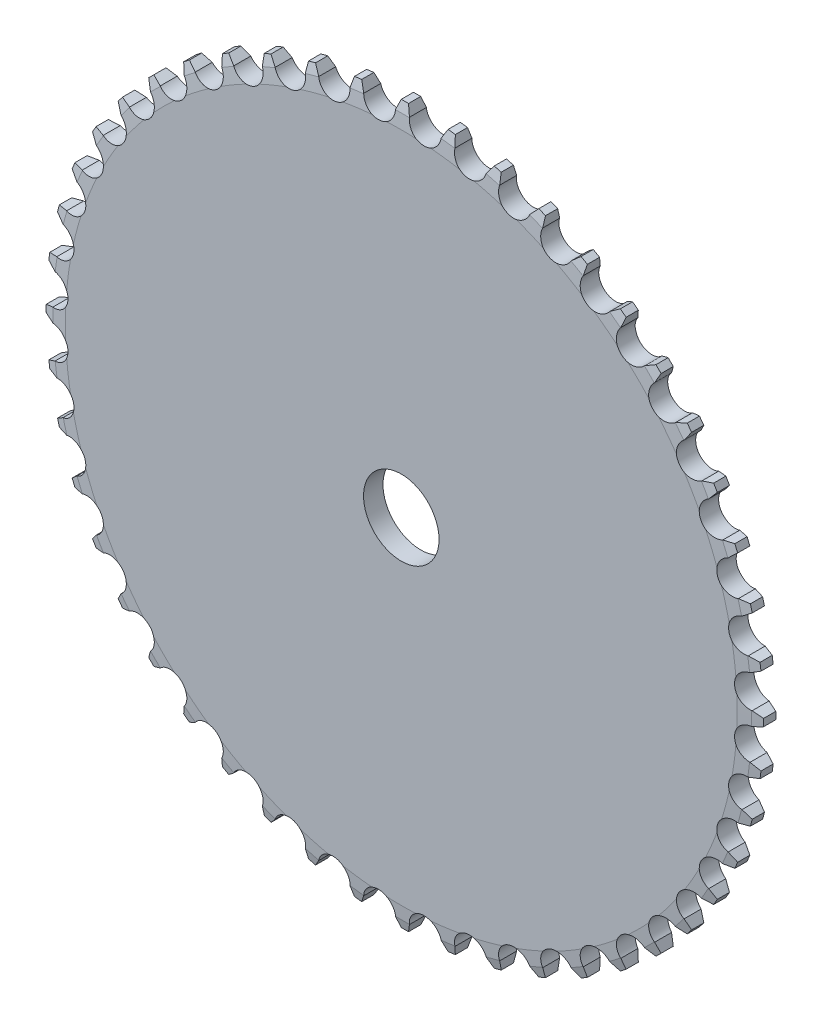
from build123d import *

# Parameters (mm, degrees)
SKETCH1_R           = 7.9375
BOSS_EXTRUDE2_DEPTH = 4.0894


with BuildPart() as part:
    # Sketch1 → Boss-Extrude2 (new body)
    with BuildSketch(Plane.XY):
        with BuildLine():
            Line((0.762, 75.421450769), (-0.762, 75.421450769))
            Line((-0.762, 75.421450769), (-1.456984931, 73.511995363))
            ThreePointArc((-1.456984931, 73.511995363), (-2.339997211, 71.173530048), (-4.594157789, 70.093302846))
            ThreePointArc((-4.594157789, 70.093302846), (-6.970031654, 70.870061558), (-8.150720614, 73.073264748))
            Line((-8.150720614, 73.073264748), (-9.088993796, 74.875670761))
            Line((-9.088993796, 74.875670761), (-10.599955765, 74.676748844))
            Line((-10.599955765, 74.676748844), (-11.03976106, 72.692915357))
            ThreePointArc((-11.03976106, 72.692915357), (-11.609988074, 70.259199706), (-13.703866053, 68.893987001))
            ThreePointArc((-13.703866053, 68.893987001), (-16.160801344, 69.353986665), (-17.61896507, 71.384230312))
            Line((-17.61896507, 71.384230312), (-18.784472389, 73.048747266))
            Line((-18.784472389, 73.048747266), (-20.256543348, 72.654307042))
            Line((-20.256543348, 72.654307042), (-20.433643817, 70.630039415))
            ThreePointArc((-20.433643817, 70.630039415), (-20.681328823, 68.142714978), (-22.579097369, 66.515875937))
            ThreePointArc((-22.579097369, 66.515875937), (-25.075055243, 66.651245832), (-26.785744149, 68.473791905))
            Line((-26.785744149, 68.473791905), (-28.15854345, 69.971939453))
            Line((-28.15854345, 69.971939453), (-29.566535858, 69.388729902))
            Line((-29.566535858, 69.388729902), (-29.477901263, 67.358663916))
            ThreePointArc((-29.477901263, 67.358663916), (-29.398806302, 64.860289504), (-31.067994069, 62.999659794))
            ThreePointArc((-31.067994069, 62.999659794), (-33.560267995, 62.808083704), (-35.494211718, 64.391747933))
            Line((-35.494211718, 64.391747933), (-37.050814027, 65.697892356))
            Line((-37.050814027, 65.697892356), (-38.370636742, 64.935892356))
            Line((-38.370636742, 64.935892356), (-38.017783645, 62.934763002))
            ThreePointArc((-38.017783645, 62.934763002), (-37.613262053, 60.468086493), (-39.025308777, 58.405502006))
            ThreePointArc((-39.025308777, 58.405502006), (-41.471255256, 57.89025785), (-43.595363485, 59.207943302))
            Line((-43.595363485, 59.207943302), (-45.309134903, 60.299736106))
            Line((-45.309134903, 60.299736106), (-46.518205393, 59.371983688))
            Line((-46.518205393, 59.371983688), (-45.907171209, 57.434030844))
            ThreePointArc((-45.907171209, 57.434030844), (-45.184144463, 55.041257758), (-46.314889632, 52.812009885))
            ThreePointArc((-46.314889632, 52.812009885), (-48.672657842, 51.981913634), (-50.950586495, 53.011074345))
            Line((-50.950586495, 53.011074345), (-52.792203918, 53.869834653))
            Line((-52.792203918, 53.869834653), (-53.869834653, 52.792203918))
            Line((-53.869834653, 52.792203918), (-53.011074345, 50.950586495))
            ThreePointArc((-53.011074345, 50.950586495), (-51.981913634, 48.672657842), (-52.812009885, 46.314889632))
            ThreePointArc((-52.812009885, 46.314889632), (-55.041257758, 45.184144463), (-57.434030844, 45.907171209))
            Line((-57.434030844, 45.907171209), (-59.371983688, 46.518205393))
            Line((-59.371983688, 46.518205393), (-60.299736106, 45.309134903))
            Line((-60.299736106, 45.309134903), (-59.207943302, 43.595363485))
            ThreePointArc((-59.207943302, 43.595363485), (-57.89025785, 41.471255256), (-58.405502006, 39.025308777))
            ThreePointArc((-58.405502006, 39.025308777), (-60.468086493, 37.613262053), (-62.934763002, 38.017783645))
            Line((-62.934763002, 38.017783645), (-64.935892356, 38.370636742))
            Line((-64.935892356, 38.370636742), (-65.697892356, 37.050814027))
            Line((-65.697892356, 37.050814027), (-64.391747933, 35.494211718))
            ThreePointArc((-64.391747933, 35.494211718), (-62.808083704, 33.560267995), (-62.999659794, 31.067994069))
            ThreePointArc((-62.999659794, 31.067994069), (-64.860289504, 29.398806302), (-67.358663916, 29.477901263))
            Line((-67.358663916, 29.477901263), (-69.388729902, 29.566535858))
            Line((-69.388729902, 29.566535858), (-69.971939453, 28.15854345))
            Line((-69.971939453, 28.15854345), (-68.473791905, 26.785744149))
            ThreePointArc((-68.473791905, 26.785744149), (-66.651245832, 25.075055243), (-66.515875937, 22.579097369))
            ThreePointArc((-66.515875937, 22.579097369), (-68.142714978, 20.681328823), (-70.630039415, 20.433643817))
            Line((-70.630039415, 20.433643817), (-72.654307042, 20.256543348))
            Line((-72.654307042, 20.256543348), (-73.048747266, 18.784472389))
            Line((-73.048747266, 18.784472389), (-71.384230312, 17.61896507))
            ThreePointArc((-71.384230312, 17.61896507), (-69.353986665, 16.160801344), (-68.893987001, 13.703866053))
            ThreePointArc((-68.893987001, 13.703866053), (-70.259199706, 11.609988074), (-72.692915357, 11.03976106))
            Line((-72.692915357, 11.03976106), (-74.676748844, 10.599955765))
            Line((-74.676748844, 10.599955765), (-74.875670761, 9.088993796))
            Line((-74.875670761, 9.088993796), (-73.073264748, 8.150720614))
            ThreePointArc((-73.073264748, 8.150720614), (-70.870061558, 6.970031654), (-70.093302846, 4.594157789))
            ThreePointArc((-70.093302846, 4.594157789), (-71.173530048, 2.339997211), (-73.511995363, 1.456984931))
            Line((-73.511995363, 1.456984931), (-75.421450769, 0.762))
            Line((-75.421450769, 0.762), (-75.421450769, -0.762))
            Line((-75.421450769, -0.762), (-73.511995363, -1.456984931))
            ThreePointArc((-73.511995363, -1.456984931), (-71.173530048, -2.339997211), (-70.093302846, -4.594157789))
            ThreePointArc((-70.093302846, -4.594157789), (-70.870061558, -6.970031654), (-73.073264748, -8.150720614))
            Line((-73.073264748, -8.150720614), (-74.875670761, -9.088993796))
            Line((-74.875670761, -9.088993796), (-74.676748844, -10.599955765))
            Line((-74.676748844, -10.599955765), (-72.692915357, -11.03976106))
            ThreePointArc((-72.692915357, -11.03976106), (-70.259199706, -11.609988074), (-68.893987001, -13.703866053))
            ThreePointArc((-68.893987001, -13.703866053), (-69.353986665, -16.160801344), (-71.384230312, -17.61896507))
            Line((-71.384230312, -17.61896507), (-73.048747266, -18.784472389))
            Line((-73.048747266, -18.784472389), (-72.654307042, -20.256543348))
            Line((-72.654307042, -20.256543348), (-70.630039415, -20.433643817))
            ThreePointArc((-70.630039415, -20.433643817), (-68.142714978, -20.681328823), (-66.515875937, -22.579097369))
            ThreePointArc((-66.515875937, -22.579097369), (-66.651245832, -25.075055243), (-68.473791905, -26.785744149))
            Line((-68.473791905, -26.785744149), (-69.971939453, -28.15854345))
            Line((-69.971939453, -28.15854345), (-69.388729902, -29.566535858))
            Line((-69.388729902, -29.566535858), (-67.358663916, -29.477901263))
            ThreePointArc((-67.358663916, -29.477901263), (-64.860289504, -29.398806302), (-62.999659794, -31.067994069))
            ThreePointArc((-62.999659794, -31.067994069), (-62.808083704, -33.560267995), (-64.391747933, -35.494211718))
            Line((-64.391747933, -35.494211718), (-65.697892356, -37.050814027))
            Line((-65.697892356, -37.050814027), (-64.935892356, -38.370636742))
            Line((-64.935892356, -38.370636742), (-62.934763002, -38.017783645))
            ThreePointArc((-62.934763002, -38.017783645), (-60.468086493, -37.613262053), (-58.405502006, -39.025308777))
            ThreePointArc((-58.405502006, -39.025308777), (-57.89025785, -41.471255256), (-59.207943302, -43.595363485))
            Line((-59.207943302, -43.595363485), (-60.299736106, -45.309134903))
            Line((-60.299736106, -45.309134903), (-59.371983688, -46.518205393))
            Line((-59.371983688, -46.518205393), (-57.434030844, -45.907171209))
            ThreePointArc((-57.434030844, -45.907171209), (-55.041257758, -45.184144463), (-52.812009885, -46.314889632))
            ThreePointArc((-52.812009885, -46.314889632), (-51.981913634, -48.672657842), (-53.011074345, -50.950586495))
            Line((-53.011074345, -50.950586495), (-53.869834653, -52.792203918))
            Line((-53.869834653, -52.792203918), (-52.792203918, -53.869834653))
            Line((-52.792203918, -53.869834653), (-50.950586495, -53.011074345))
            ThreePointArc((-50.950586495, -53.011074345), (-48.672657842, -51.981913634), (-46.314889632, -52.812009885))
            ThreePointArc((-46.314889632, -52.812009885), (-45.184144463, -55.041257758), (-45.907171209, -57.434030844))
            Line((-45.907171209, -57.434030844), (-46.518205393, -59.371983688))
            Line((-46.518205393, -59.371983688), (-45.309134903, -60.299736106))
            Line((-45.309134903, -60.299736106), (-43.595363485, -59.207943302))
            ThreePointArc((-43.595363485, -59.207943302), (-41.471255256, -57.89025785), (-39.025308777, -58.405502006))
            ThreePointArc((-39.025308777, -58.405502006), (-37.613262053, -60.468086493), (-38.017783645, -62.934763002))
            Line((-38.017783645, -62.934763002), (-38.370636742, -64.935892356))
            Line((-38.370636742, -64.935892356), (-37.050814027, -65.697892356))
            Line((-37.050814027, -65.697892356), (-35.494211718, -64.391747933))
            ThreePointArc((-35.494211718, -64.391747933), (-33.560267995, -62.808083704), (-31.067994069, -62.999659794))
            ThreePointArc((-31.067994069, -62.999659794), (-29.398806302, -64.860289504), (-29.477901263, -67.358663916))
            Line((-29.477901263, -67.358663916), (-29.566535858, -69.388729902))
            Line((-29.566535858, -69.388729902), (-28.15854345, -69.971939453))
            Line((-28.15854345, -69.971939453), (-26.785744149, -68.473791905))
            ThreePointArc((-26.785744149, -68.473791905), (-25.075055243, -66.651245832), (-22.579097369, -66.515875937))
            ThreePointArc((-22.579097369, -66.515875937), (-20.681328823, -68.142714978), (-20.433643817, -70.630039415))
            Line((-20.433643817, -70.630039415), (-20.256543348, -72.654307042))
            Line((-20.256543348, -72.654307042), (-18.784472389, -73.048747266))
            Line((-18.784472389, -73.048747266), (-17.61896507, -71.384230312))
            ThreePointArc((-17.61896507, -71.384230312), (-16.160801344, -69.353986665), (-13.703866053, -68.893987001))
            ThreePointArc((-13.703866053, -68.893987001), (-11.609988074, -70.259199706), (-11.03976106, -72.692915357))
            Line((-11.03976106, -72.692915357), (-10.599955765, -74.676748844))
            Line((-10.599955765, -74.676748844), (-9.088993796, -74.875670761))
            Line((-9.088993796, -74.875670761), (-8.150720614, -73.073264748))
            ThreePointArc((-8.150720614, -73.073264748), (-6.970031654, -70.870061558), (-4.594157789, -70.093302846))
            ThreePointArc((-4.594157789, -70.093302846), (-2.339997211, -71.173530048), (-1.456984931, -73.511995363))
            Line((-1.456984931, -73.511995363), (-0.762, -75.421450769))
            Line((-0.762, -75.421450769), (0.762, -75.421450769))
            Line((0.762, -75.421450769), (1.456984931, -73.511995363))
            ThreePointArc((1.456984931, -73.511995363), (2.339997211, -71.173530048), (4.594157789, -70.093302846))
            ThreePointArc((4.594157789, -70.093302846), (6.970031654, -70.870061558), (8.150720614, -73.073264748))
            Line((8.150720614, -73.073264748), (9.088993796, -74.875670761))
            Line((9.088993796, -74.875670761), (10.599955765, -74.676748844))
            Line((10.599955765, -74.676748844), (11.03976106, -72.692915357))
            ThreePointArc((11.03976106, -72.692915357), (11.609988074, -70.259199706), (13.703866053, -68.893987001))
            ThreePointArc((13.703866053, -68.893987001), (16.160801344, -69.353986665), (17.61896507, -71.384230312))
            Line((17.61896507, -71.384230312), (18.784472389, -73.048747266))
            Line((18.784472389, -73.048747266), (20.256543348, -72.654307042))
            Line((20.256543348, -72.654307042), (20.433643817, -70.630039415))
            ThreePointArc((20.433643817, -70.630039415), (20.681328823, -68.142714978), (22.579097369, -66.515875937))
            ThreePointArc((22.579097369, -66.515875937), (25.075055243, -66.651245832), (26.785744149, -68.473791905))
            Line((26.785744149, -68.473791905), (28.15854345, -69.971939453))
            Line((28.15854345, -69.971939453), (29.566535858, -69.388729902))
            Line((29.566535858, -69.388729902), (29.477901263, -67.358663916))
            ThreePointArc((29.477901263, -67.358663916), (29.398806302, -64.860289504), (31.067994069, -62.999659794))
            ThreePointArc((31.067994069, -62.999659794), (33.560267995, -62.808083704), (35.494211718, -64.391747933))
            Line((35.494211718, -64.391747933), (37.050814027, -65.697892356))
            Line((37.050814027, -65.697892356), (38.370636742, -64.935892356))
            Line((38.370636742, -64.935892356), (38.017783645, -62.934763002))
            ThreePointArc((38.017783645, -62.934763002), (37.613262053, -60.468086493), (39.025308777, -58.405502006))
            ThreePointArc((39.025308777, -58.405502006), (41.471255256, -57.89025785), (43.595363485, -59.207943302))
            Line((43.595363485, -59.207943302), (45.309134903, -60.299736106))
            Line((45.309134903, -60.299736106), (46.518205393, -59.371983688))
            Line((46.518205393, -59.371983688), (45.907171209, -57.434030844))
            ThreePointArc((45.907171209, -57.434030844), (45.184144463, -55.041257758), (46.314889632, -52.812009885))
            ThreePointArc((46.314889632, -52.812009885), (48.672657842, -51.981913634), (50.950586495, -53.011074345))
            Line((50.950586495, -53.011074345), (52.792203918, -53.869834653))
            Line((52.792203918, -53.869834653), (53.869834653, -52.792203918))
            Line((53.869834653, -52.792203918), (53.011074345, -50.950586495))
            ThreePointArc((53.011074345, -50.950586495), (51.981913634, -48.672657842), (52.812009885, -46.314889632))
            ThreePointArc((52.812009885, -46.314889632), (55.041257758, -45.184144463), (57.434030844, -45.907171209))
            Line((57.434030844, -45.907171209), (59.371983688, -46.518205393))
            Line((59.371983688, -46.518205393), (60.299736106, -45.309134903))
            Line((60.299736106, -45.309134903), (59.207943302, -43.595363485))
            ThreePointArc((59.207943302, -43.595363485), (57.89025785, -41.471255256), (58.405502006, -39.025308777))
            ThreePointArc((58.405502006, -39.025308777), (60.468086493, -37.613262053), (62.934763002, -38.017783645))
            Line((62.934763002, -38.017783645), (64.935892356, -38.370636742))
            Line((64.935892356, -38.370636742), (65.697892356, -37.050814027))
            Line((65.697892356, -37.050814027), (64.391747933, -35.494211718))
            ThreePointArc((64.391747933, -35.494211718), (62.808083704, -33.560267995), (62.999659794, -31.067994069))
            ThreePointArc((62.999659794, -31.067994069), (64.860289504, -29.398806302), (67.358663916, -29.477901263))
            Line((67.358663916, -29.477901263), (69.388729902, -29.566535858))
            Line((69.388729902, -29.566535858), (69.971939453, -28.15854345))
            Line((69.971939453, -28.15854345), (68.473791905, -26.785744149))
            ThreePointArc((68.473791905, -26.785744149), (66.651245832, -25.075055243), (66.515875937, -22.579097369))
            ThreePointArc((66.515875937, -22.579097369), (68.142714978, -20.681328823), (70.630039415, -20.433643817))
            Line((70.630039415, -20.433643817), (72.654307042, -20.256543348))
            Line((72.654307042, -20.256543348), (73.048747266, -18.784472389))
            Line((73.048747266, -18.784472389), (71.384230312, -17.61896507))
            ThreePointArc((71.384230312, -17.61896507), (69.353986665, -16.160801344), (68.893987001, -13.703866053))
            ThreePointArc((68.893987001, -13.703866053), (70.259199706, -11.609988074), (72.692915357, -11.03976106))
            Line((72.692915357, -11.03976106), (74.676748844, -10.599955765))
            Line((74.676748844, -10.599955765), (74.875670761, -9.088993796))
            Line((74.875670761, -9.088993796), (73.073264748, -8.150720614))
            ThreePointArc((73.073264748, -8.150720614), (70.870061558, -6.970031654), (70.093302846, -4.594157789))
            ThreePointArc((70.093302846, -4.594157789), (71.173530048, -2.339997211), (73.511995363, -1.456984931))
            Line((73.511995363, -1.456984931), (75.421450769, -0.762))
            Line((75.421450769, -0.762), (75.421450769, 0.762))
            Line((75.421450769, 0.762), (73.511995363, 1.456984931))
            ThreePointArc((73.511995363, 1.456984931), (71.173530048, 2.339997211), (70.093302846, 4.594157789))
            ThreePointArc((70.093302846, 4.594157789), (70.870061558, 6.970031654), (73.073264748, 8.150720614))
            Line((73.073264748, 8.150720614), (74.875670761, 9.088993796))
            Line((74.875670761, 9.088993796), (74.676748844, 10.599955765))
            Line((74.676748844, 10.599955765), (72.692915357, 11.03976106))
            ThreePointArc((72.692915357, 11.03976106), (70.259199706, 11.609988074), (68.893987001, 13.703866053))
            ThreePointArc((68.893987001, 13.703866053), (69.353986665, 16.160801344), (71.384230312, 17.61896507))
            Line((71.384230312, 17.61896507), (73.048747266, 18.784472389))
            Line((73.048747266, 18.784472389), (72.654307042, 20.256543348))
            Line((72.654307042, 20.256543348), (70.630039415, 20.433643817))
            ThreePointArc((70.630039415, 20.433643817), (68.142714978, 20.681328823), (66.515875937, 22.579097369))
            ThreePointArc((66.515875937, 22.579097369), (66.651245832, 25.075055243), (68.473791905, 26.785744149))
            Line((68.473791905, 26.785744149), (69.971939453, 28.15854345))
            Line((69.971939453, 28.15854345), (69.388729902, 29.566535858))
            Line((69.388729902, 29.566535858), (67.358663916, 29.477901263))
            ThreePointArc((67.358663916, 29.477901263), (64.860289504, 29.398806302), (62.999659794, 31.067994069))
            ThreePointArc((62.999659794, 31.067994069), (62.808083704, 33.560267995), (64.391747933, 35.494211718))
            Line((64.391747933, 35.494211718), (65.697892356, 37.050814027))
            Line((65.697892356, 37.050814027), (64.935892356, 38.370636742))
            Line((64.935892356, 38.370636742), (62.934763002, 38.017783645))
            ThreePointArc((62.934763002, 38.017783645), (60.468086493, 37.613262053), (58.405502006, 39.025308777))
            ThreePointArc((58.405502006, 39.025308777), (57.89025785, 41.471255256), (59.207943302, 43.595363485))
            Line((59.207943302, 43.595363485), (60.299736106, 45.309134903))
            Line((60.299736106, 45.309134903), (59.371983688, 46.518205393))
            Line((59.371983688, 46.518205393), (57.434030844, 45.907171209))
            ThreePointArc((57.434030844, 45.907171209), (55.041257758, 45.184144463), (52.812009885, 46.314889632))
            ThreePointArc((52.812009885, 46.314889632), (51.981913634, 48.672657842), (53.011074345, 50.950586495))
            Line((53.011074345, 50.950586495), (53.869834653, 52.792203918))
            Line((53.869834653, 52.792203918), (52.792203918, 53.869834653))
            Line((52.792203918, 53.869834653), (50.950586495, 53.011074345))
            ThreePointArc((50.950586495, 53.011074345), (48.672657842, 51.981913634), (46.314889632, 52.812009885))
            ThreePointArc((46.314889632, 52.812009885), (45.184144463, 55.041257758), (45.907171209, 57.434030844))
            Line((45.907171209, 57.434030844), (46.518205393, 59.371983688))
            Line((46.518205393, 59.371983688), (45.309134903, 60.299736106))
            Line((45.309134903, 60.299736106), (43.595363485, 59.207943302))
            ThreePointArc((43.595363485, 59.207943302), (41.471255256, 57.89025785), (39.025308777, 58.405502006))
            ThreePointArc((39.025308777, 58.405502006), (37.613262053, 60.468086493), (38.017783645, 62.934763002))
            Line((38.017783645, 62.934763002), (38.370636742, 64.935892356))
            Line((38.370636742, 64.935892356), (37.050814027, 65.697892356))
            Line((37.050814027, 65.697892356), (35.494211718, 64.391747933))
            ThreePointArc((35.494211718, 64.391747933), (33.560267995, 62.808083704), (31.067994069, 62.999659794))
            ThreePointArc((31.067994069, 62.999659794), (29.398806302, 64.860289504), (29.477901263, 67.358663916))
            Line((29.477901263, 67.358663916), (29.566535858, 69.388729902))
            Line((29.566535858, 69.388729902), (28.15854345, 69.971939453))
            Line((28.15854345, 69.971939453), (26.785744149, 68.473791905))
            ThreePointArc((26.785744149, 68.473791905), (25.075055243, 66.651245832), (22.579097369, 66.515875937))
            ThreePointArc((22.579097369, 66.515875937), (20.681328823, 68.142714978), (20.433643817, 70.630039415))
            Line((20.433643817, 70.630039415), (20.256543348, 72.654307042))
            Line((20.256543348, 72.654307042), (18.784472389, 73.048747266))
            Line((18.784472389, 73.048747266), (17.61896507, 71.384230312))
            ThreePointArc((17.61896507, 71.384230312), (16.160801344, 69.353986665), (13.703866053, 68.893987001))
            ThreePointArc((13.703866053, 68.893987001), (11.609988074, 70.259199706), (11.03976106, 72.692915357))
            Line((11.03976106, 72.692915357), (10.599955765, 74.676748844))
            Line((10.599955765, 74.676748844), (9.088993796, 74.875670761))
            Line((9.088993796, 74.875670761), (8.150720614, 73.073264748))
            ThreePointArc((8.150720614, 73.073264748), (6.970031654, 70.870061558), (4.594157789, 70.093302846))
            ThreePointArc((4.594157789, 70.093302846), (2.339997211, 71.173530048), (1.456984931, 73.511995363))
            Line((1.456984931, 73.511995363), (0.762, 75.421450769))
        make_face()
        Circle(SKETCH1_R, mode=Mode.SUBTRACT)
    extrude(amount=BOSS_EXTRUDE2_DEPTH)

    # Sketch3 → Cut-Revolve3 (revolve, cut)
    with BuildSketch(Plane(origin=(0, 0, 0), x_dir=(0, 0, -1), z_dir=(1, 0, 0))):
        Polygon((-3.848714616, 73.457461189), (-3.3274, 75.421450769), (-3.3274, 76.364789012), (-4.752293352, 76.364789012), (-4.752293352, 70.630039415), (-4.0894, 70.630039415), align=None)
        Polygon((0, 70.630039415), (0.662893352, 70.630039415), (0.662893352, 76.364789012), (-0.762, 76.364789012), (-0.762, 75.421450769), (-0.240685384, 73.457461189), align=None)
    revolve(axis=Axis((0, 0, 4.0894), (0, 0, -1)), mode=Mode.SUBTRACT)


solid = part.part
